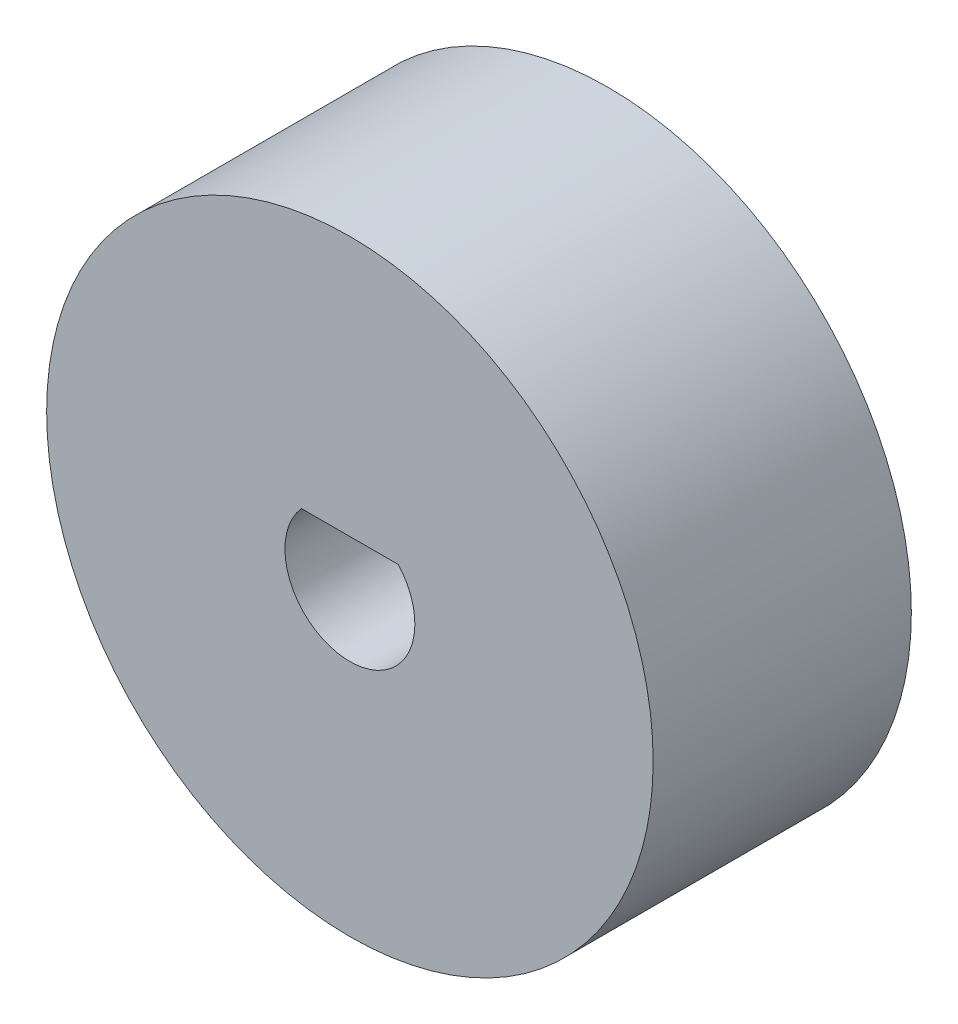
from build123d import *

# Parameters (mm, degrees)
SKETCH1_R                       = 7
SKETCH1_R_2                     = 2.5
BOSS_EXTRUDE2_DEPTH             = 2.98
BOSS_EXTRUDE3_REACH             = 12.338
SKETCH1_5_R                     = 2.5
BOSS_EXTRUDE3_DIRECTION_2_REACH = 12.338


with BuildPart() as part:
    # Sketch1 → Boss-Extrude2 (new, symmetric)
    with BuildSketch(Plane.XY):
        Circle(SKETCH1_R)
        Circle(SKETCH1_R_2, mode=Mode.SUBTRACT)
    extrude(amount=BOSS_EXTRUDE2_DEPTH, both=True)

    # Boss-Extrude3: up to this face of the body (flat: up to its plane)
    boss_extrude3_end = Plane(part.part.faces().sort_by_distance((-6.802010101, 0, 2.98))[0])
    # Sketch1<5> → Boss-Extrude3 (add, up to the picked face)
    with BuildSketch(Plane.XY, mode=Mode.PRIVATE) as boss_extrude3_sk1:
        Circle(SKETCH1_5_R)
        with BuildLine():
            ThreePointArc((1.118033989, 1), (0, -1.5), (-1.118033989, 1))
            Line((-1.118033989, 1), (1.118033989, 1))
        make_face(mode=Mode.SUBTRACT)
    boss_extrude3_tool1 = split(extrude(boss_extrude3_sk1.sketch, amount=BOSS_EXTRUDE3_REACH, mode=Mode.PRIVATE), bisect_by=boss_extrude3_end, keep=Keep.BOTH, mode=Mode.PRIVATE)
    add(boss_extrude3_tool1.solids().sort_by(Axis((-2.429289, 0, 0), (0, 0, 1)))[0])

    # Boss-Extrude3 direction 2: up to this face of the body (flat: up to its plane)
    boss_extrude3_direction_2_end = Plane(part.part.faces().sort_by_distance((-6.802010101, 0, -2.98))[0])
    # Sketch1<5> → Boss-Extrude3 direction 2 (add, up to the picked face)
    with BuildSketch(Plane.XY, mode=Mode.PRIVATE) as boss_extrude3_direction_2_sk1:
        Circle(SKETCH1_5_R)
        with BuildLine():
            ThreePointArc((1.118033989, 1), (0, -1.5), (-1.118033989, 1))
            Line((-1.118033989, 1), (1.118033989, 1))
        make_face(mode=Mode.SUBTRACT)
    boss_extrude3_direction_2_tool1 = split(extrude(boss_extrude3_direction_2_sk1.sketch, amount=-BOSS_EXTRUDE3_DIRECTION_2_REACH, mode=Mode.PRIVATE), bisect_by=boss_extrude3_direction_2_end, keep=Keep.BOTH, mode=Mode.PRIVATE)
    add(boss_extrude3_direction_2_tool1.solids().sort_by(Axis((-2.429289, 0, 0), (0, 0, -1)))[0])


solid = part.part
